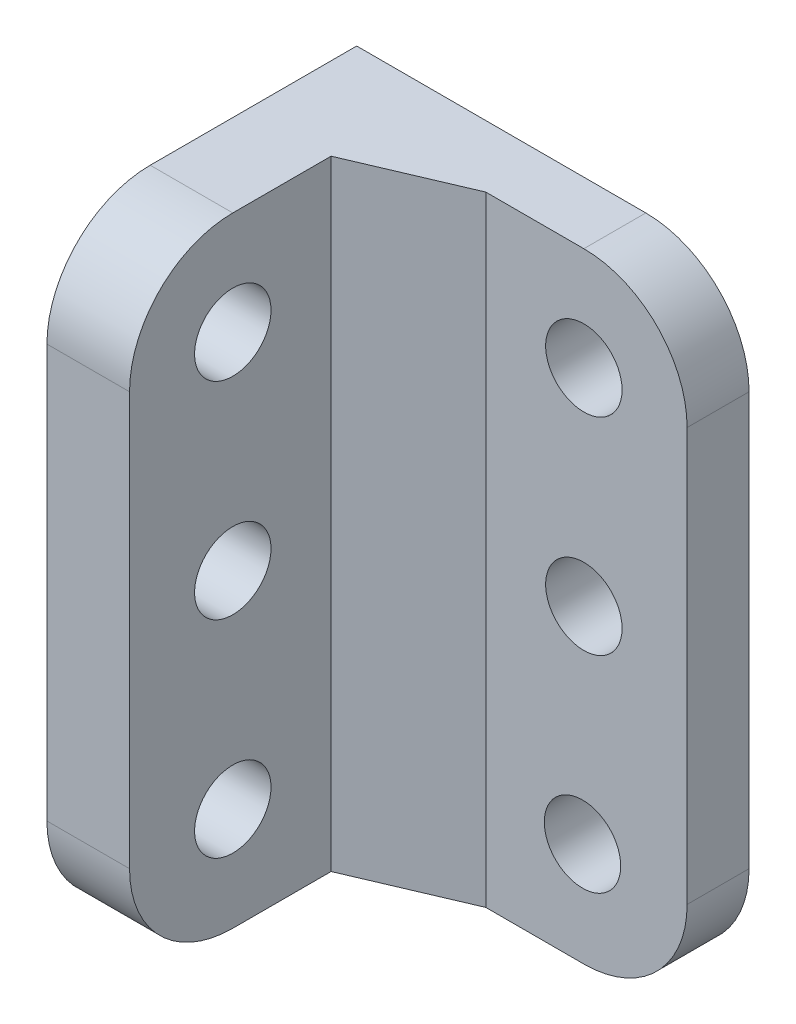
from build123d import *

# Parameters (mm, degrees)
BASE_EXTRUDE_DEPTH      = 38.1
SKETCH2_R               = 2.3495
MOTOR_HOLE_CUT_DEPTH    = 48.603828628
SKETCH3_R               = 2.3495
MOUNTING_HOLE_CUT_DEPTH = 47.6627796
CORNER_FILLETS_R        = 6.35


with BuildPart() as part:
    # Sketch1 → Base Extrude (new body)
    with BuildSketch(Plane(origin=(0, 0, 0), x_dir=(1, 0, 0), z_dir=(0, 1, 0))):
        Polygon((0, 0), (24.13, 0), (24.13, -3.81), (11.7475, -3.81), (5.08, -6.6548), (5.08, -19.05), (0, -19.05), align=None)
    extrude(amount=BASE_EXTRUDE_DEPTH)

    # Sketch2 → Motor Hole Cut (cut, through all)
    with BuildSketch(Plane.XY.offset(3.81)):
        with Locations((17.697323232, 6.35)):
            Circle(SKETCH2_R)
        with Locations((17.78, 19.05)):
            Circle(SKETCH2_R)
        with Locations((17.78, 31.75)):
            Circle(SKETCH2_R)
    extrude(amount=-MOTOR_HOLE_CUT_DEPTH, mode=Mode.SUBTRACT)

    # Sketch3 → Mounting Hole Cut (cut, through all)
    with BuildSketch(Plane(origin=(5.08, 0, 0), x_dir=(0, 0, -1), z_dir=(1, 0, 0))):
        with Locations((-12.7, 31.75)):
            Circle(SKETCH3_R)
        with Locations((-12.7, 19.05)):
            Circle(SKETCH3_R)
        with Locations((-12.7, 6.35)):
            Circle(SKETCH3_R)
    extrude(amount=-MOUNTING_HOLE_CUT_DEPTH, mode=Mode.SUBTRACT)

    # Corner Fillets
    corner_fillets_edges = [part.edges().sort_by_distance(p)[0] for p in [
        (24.13, 38.1, 1.905),
        (24.13, 0, 1.905),
        (2.54, 0, 19.05),
        (2.54, 38.1, 19.05),
    ]]
    fillet(corner_fillets_edges, radius=CORNER_FILLETS_R)


solid = part.part
